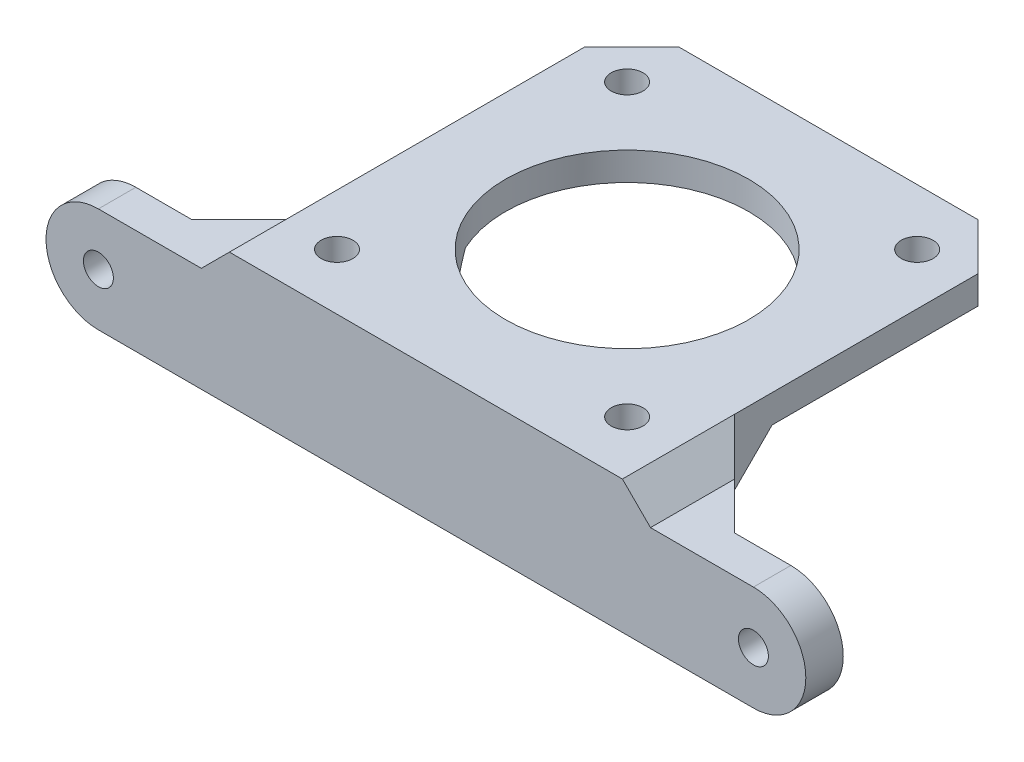
from build123d import *

# Parameters (mm, degrees)
ESBO_O1_R                = 1.6
RESSALTO_EXTRUS_O1_DEPTH = 4
ESBO_O2_W                = 42
ESBO_O2_H                = 43
ESBO_O2_R                = 13
RESSALTO_EXTRUS_O2_DEPTH = 3
CHANFRO1_SIZE            = 3
CHANFRO2_SIZE            = 5
CHANFRO3_SIZE            = 12
ESBO_O3_R                = 1.7
CORTE_EXTRUS_O1_DEPTH    = 59.060313468
ESBO_O4_R                = 3.5
CORTE_EXTRUS_O2_DEPTH    = 58.400348431
CHANFRO4_SIZE            = 8


# Some blends are built 0.0001 mm under size
with BuildPart() as part:
    # Esboço1 → Ressalto-extrusão1 (new body)
    with BuildSketch(Plane.XY):
        with BuildLine():
            Line((-35, 5.6), (35, 5.6))
            ThreePointArc((35, 5.6), (40.6, 0), (35, -5.6))
            Line((35, -5.6), (-35, -5.6))
            ThreePointArc((-35, -5.6), (-40.6, 0), (-35, 5.6))
        make_face()
        with Locations((35, 0)):
            Circle(ESBO_O1_R, mode=Mode.SUBTRACT)
        with Locations((-35, 0)):
            Circle(ESBO_O1_R, mode=Mode.SUBTRACT)
    extrude(amount=RESSALTO_EXTRUS_O1_DEPTH)

    # Esboço2 → Ressalto-extrusão2 (add)
    with BuildSketch(Plane(origin=(0, 5.6, 0), x_dir=(1, 0, 0), z_dir=(0, 1, 0))):
        with Locations((0, 17.5)):
            Rectangle(ESBO_O2_W, ESBO_O2_H)
        with Locations(Location((0, 17.5, 0), (0, 0, 180))):
            Circle(ESBO_O2_R, mode=Mode.SUBTRACT)
    extrude(amount=RESSALTO_EXTRUS_O2_DEPTH)

    # Chanfro1
    chanfro1_edges = [part.edges().sort_by_distance(p)[0] for p in [
        (21, 5.6, 2),
        (-21, 5.6, 2),
    ]]
    chamfer(chanfro1_edges, length=CHANFRO1_SIZE - 0.0001)  # a hair under: the kernel refuses the full size

    # Chanfro2
    chanfro2_edges = [part.edges().sort_by_distance(p)[0] for p in [
        (21, 7.1, -39),
        (-21, 7.1, -39),
    ]]
    chamfer(chanfro2_edges, length=CHANFRO2_SIZE)

    # Chanfro3
    # the kernel refuses this chamfer: 12 mm, written as the material it adds along each edge
    with BuildSketch(Plane(origin=(-21, 5.6, 0), x_dir=(0, 0.027495876610586417, -0.9996219169112968), z_dir=(1, 0, 0))) as chanfro3_piece_1_section:
        Polygon((CHANFRO3_SIZE * 0.999621916911, -CHANFRO3_SIZE * 0.0274958766106), (-CHANFRO3_SIZE * 0.0274958766106, -CHANFRO3_SIZE * 0.999621916911), (0, 0), align=None)
    chanfro3_piece_1 = extrude(amount=42, mode=Mode.PRIVATE)
    chanfro3_piece_1 = chanfro3_piece_1 - Plane(origin=(0, 1.3654596, -17.5), x_dir=(-1, 0, 0), z_dir=(0, -1, 0)) * Cylinder(13, 132, mode=Mode.PRIVATE)
    chanfro3_piece_1 = split(chanfro3_piece_1, bisect_by=Plane(origin=(0, -5.6, -3.473436689), z_dir=(0, 1, 0)), keep=Keep.TOP, mode=Mode.PRIVATE)
    add(chanfro3_piece_1)

    # Esboço3 → Corte-extrusão1 (cut, through all)
    with BuildSketch(Plane(origin=(0, 8.6, 0), x_dir=(1, 0, 0), z_dir=(0, 1, 0))):
        with Locations(Location((-15.5, 33, 0), (0, 0, 180))):
            Circle(ESBO_O3_R)
        with Locations(Location((15.5, 33, 0), (0, 0, 180))):
            Circle(ESBO_O3_R)
        with Locations(Location((15.5, 2, 0), (0, 0, 180))):
            Circle(ESBO_O3_R)
        with Locations(Location((-15.5, 2, 0), (0, 0, 224.900872156))):
            Circle(ESBO_O3_R)
    extrude(amount=-CORTE_EXTRUS_O1_DEPTH, mode=Mode.SUBTRACT)

    # Esboço4 → Corte-extrusão2 (cut, through all)
    with BuildSketch(Plane.XZ.offset(-5.6)):
        with Locations(Location((-15.5, -2, 0), (0, 0, 159.948957433))):
            Circle(ESBO_O4_R)
        with Locations(Location((15.5, -2, 0), (0, 0, 159.948957433))):
            Circle(ESBO_O4_R)
        with Locations((15.5, -33)):
            Circle(ESBO_O4_R)
        with Locations((-15.5, -33)):
            Circle(ESBO_O4_R)
    extrude(amount=CORTE_EXTRUS_O2_DEPTH, mode=Mode.SUBTRACT)

    # Chanfro4
    # the kernel refuses this chamfer: 8 mm, written as the material it adds along each edge
    with BuildSketch(Plane(origin=(21, 29.173363904, 0), x_dir=(-0.027495876610586494, 3.1525903256593395e-13, -0.9996219169112968), z_dir=(0, -1, 0))) as chanfro4_piece_1_section:
        Polygon((CHANFRO4_SIZE * 0.999621916911, CHANFRO4_SIZE * 0.0274958766106), (-CHANFRO4_SIZE * 0.0274958766106, CHANFRO4_SIZE * 0.999621916911), (0, 0), align=None)
    chanfro4_piece_1 = extrude(amount=34.773363904, mode=Mode.PRIVATE)
    chanfro4_piece_1 = split(chanfro4_piece_1, bisect_by=Plane(origin=(26.011530684, 3.588369316, -1.04435595), z_dir=(0.7071067811865474, 0.7071067811865478, 0)), keep=Keep.TOP, mode=Mode.PRIVATE)
    chanfro4_piece_1 = split(chanfro4_piece_1, bisect_by=Plane(origin=(26.682074245, 5.6, -1.04435595), z_dir=(0, -1, 0)), keep=Keep.TOP, mode=Mode.PRIVATE)
    add(chanfro4_piece_1)
    with BuildSketch(Plane(origin=(21, 29.173363904, 0), x_dir=(-0.027495876610586494, 3.1525903256593395e-13, -0.9996219169112968), z_dir=(0, -1, 0))) as chanfro4_piece_2_section:
        Polygon((CHANFRO4_SIZE * 0.999621916911, CHANFRO4_SIZE * 0.0274958766106), (-CHANFRO4_SIZE * 0.0274958766106, CHANFRO4_SIZE * 0.999621916911), (0, 0), align=None)
    chanfro4_piece_2 = extrude(amount=34.773363904, mode=Mode.PRIVATE)
    chanfro4_piece_2 = split(chanfro4_piece_2, bisect_by=Plane(origin=(22.348256975, 7.251643025, -3.639481653), z_dir=(-0.7071067811865474, -0.7071067811865478, 0)), keep=Keep.TOP, mode=Mode.PRIVATE)
    chanfro4_piece_2 = split(chanfro4_piece_2, bisect_by=Plane(origin=(21.792799579, 8.6, -3.639481653), z_dir=(0, -1, 0)), keep=Keep.TOP, mode=Mode.PRIVATE)
    chanfro4_piece_2 = split(chanfro4_piece_2, bisect_by=Plane(origin=(21.792799579, 5.6, -3.639481653), z_dir=(0, 1, 0)), keep=Keep.TOP, mode=Mode.PRIVATE)
    add(chanfro4_piece_2)
    with BuildSketch(Plane(origin=(21, 29.173363904, 0), x_dir=(-0.027495876610586494, 3.1525903256593395e-13, -0.9996219169112968), z_dir=(0, -1, 0))) as chanfro4_piece_3_section:
        Polygon((CHANFRO4_SIZE * 0.999621916911, CHANFRO4_SIZE * 0.0274958766106), (-CHANFRO4_SIZE * 0.0274958766106, CHANFRO4_SIZE * 0.999621916911), (0, 0), align=None)
    chanfro4_piece_3 = extrude(amount=34.773363904, mode=Mode.PRIVATE)
    chanfro4_piece_3 = split(chanfro4_piece_3, bisect_by=Plane(origin=(23.6247191, -1.786159604, -4.613840396), z_dir=(0, 0.7071067811862648, 0.7071067811868302)), keep=Keep.TOP, mode=Mode.PRIVATE)
    chanfro4_piece_3 = split(chanfro4_piece_3, bisect_by=Plane(origin=(26.361426714, 3.238473286, -2.325915119), z_dir=(-0.7071067811865474, -0.7071067811865478, 0)), keep=Keep.TOP, mode=Mode.PRIVATE)
    chanfro4_piece_3 = split(chanfro4_piece_3, bisect_by=Plane(origin=(23.6247191, 5.6, -2.325915119), z_dir=(0, -1, 0)), keep=Keep.TOP, mode=Mode.PRIVATE)
    add(chanfro4_piece_3)
    with BuildSketch(Plane(origin=(-21, -5.6, 0), x_dir=(0.027495876610578507, 3.1525903256593415e-13, -0.999621916911297), z_dir=(0, 1, 0))) as chanfro4_piece_4_section:
        Polygon((CHANFRO4_SIZE * 0.999621916911, CHANFRO4_SIZE * 0.0274958766106), (-CHANFRO4_SIZE * 0.0274958766111, CHANFRO4_SIZE * 0.999621916911), (0, 0), align=None)
    chanfro4_piece_4 = extrude(amount=34.773363904, mode=Mode.PRIVATE)
    chanfro4_piece_4 = split(chanfro4_piece_4, bisect_by=Plane(origin=(-23.6247191, -1.786159604, -4.613840396), z_dir=(0, 0.7071067811862648, 0.7071067811868302)), keep=Keep.TOP, mode=Mode.PRIVATE)
    chanfro4_piece_4 = split(chanfro4_piece_4, bisect_by=Plane(origin=(-26.361426714, 3.238473286, -2.325915119), z_dir=(0.7071067811865477, -0.7071067811865475, 0)), keep=Keep.TOP, mode=Mode.PRIVATE)
    chanfro4_piece_4 = split(chanfro4_piece_4, bisect_by=Plane(origin=(-23.6247191, 5.6, -2.325915119), z_dir=(0, -1, 0)), keep=Keep.TOP, mode=Mode.PRIVATE)
    add(chanfro4_piece_4)
    with BuildSketch(Plane(origin=(-21, -5.6, 0), x_dir=(0.027495876610578507, 3.1525903256593415e-13, -0.999621916911297), z_dir=(0, 1, 0))) as chanfro4_piece_5_section:
        Polygon((CHANFRO4_SIZE * 0.999621916911, CHANFRO4_SIZE * 0.0274958766106), (-CHANFRO4_SIZE * 0.0274958766111, CHANFRO4_SIZE * 0.999621916911), (0, 0), align=None)
    chanfro4_piece_5 = extrude(amount=34.773363904, mode=Mode.PRIVATE)
    chanfro4_piece_5 = split(chanfro4_piece_5, bisect_by=Plane(origin=(-26.011530684, 3.588369316, -1.04435595), z_dir=(-0.7071067811865477, 0.7071067811865475, 0)), keep=Keep.TOP, mode=Mode.PRIVATE)
    chanfro4_piece_5 = split(chanfro4_piece_5, bisect_by=Plane(origin=(-26.682074245, 5.6, -1.04435595), z_dir=(0, -1, 0)), keep=Keep.TOP, mode=Mode.PRIVATE)
    add(chanfro4_piece_5)
    with BuildSketch(Plane(origin=(-21, -5.6, 0), x_dir=(0.027495876610578507, 3.1525903256593415e-13, -0.999621916911297), z_dir=(0, 1, 0))) as chanfro4_piece_6_section:
        Polygon((CHANFRO4_SIZE * 0.999621916911, CHANFRO4_SIZE * 0.0274958766106), (-CHANFRO4_SIZE * 0.0274958766111, CHANFRO4_SIZE * 0.999621916911), (0, 0), align=None)
    chanfro4_piece_6 = extrude(amount=34.773363904, mode=Mode.PRIVATE)
    chanfro4_piece_6 = split(chanfro4_piece_6, bisect_by=Plane(origin=(-22.348256975, 7.251643025, -3.639481653), z_dir=(0.7071067811865477, -0.7071067811865475, 0)), keep=Keep.TOP, mode=Mode.PRIVATE)
    chanfro4_piece_6 = split(chanfro4_piece_6, bisect_by=Plane(origin=(-21.792799579, 8.6, -3.639481653), z_dir=(0, -1, 0)), keep=Keep.TOP, mode=Mode.PRIVATE)
    chanfro4_piece_6 = split(chanfro4_piece_6, bisect_by=Plane(origin=(-21.792799579, 5.6, -3.639481653), z_dir=(0, 1, 0)), keep=Keep.TOP, mode=Mode.PRIVATE)
    add(chanfro4_piece_6)


solid = part.part
